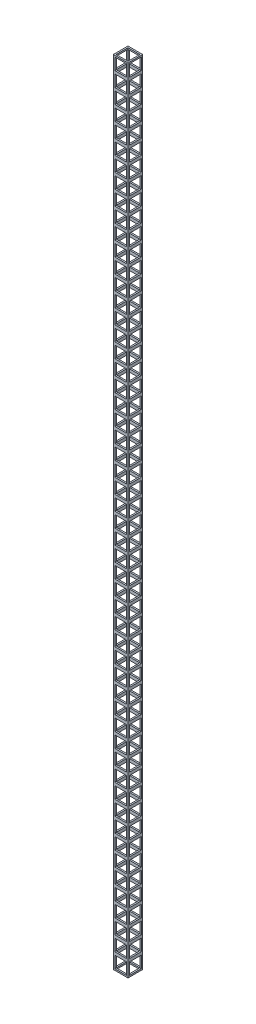
from build123d import *

# Parameters (mm, degrees)
SKIZZE1_W                       = 50
SKIZZE1_H                       = 50
AUFSATZ_LINEAR_AUSTRAGEN1_DEPTH = 2700
SKIZZE2_W                       = 40
SKIZZE2_H                       = 40
SCHNITT_LINEAR_AUSTRAGEN1_DEPTH = 2701.925767214
SKIZZE3_W                       = 40
SKIZZE3_H                       = 40
SCHNITT_LINEAR_AUSTRAGEN2_DEPTH = 2701.925767214
LINEARES_MUSTER1_COUNT          = 54
LINEARES_MUSTER1_PITCH          = 50
SKIZZE4_W                       = 40
SKIZZE4_H                       = 40
SCHNITT_LINEAR_AUSTRAGEN3_DEPTH = 2701.925767214
LINEARES_MUSTER2_COUNT          = 54
LINEARES_MUSTER2_PITCH          = 50


with BuildPart() as part:
    # Skizze1 → Aufsatz-Linear austragen1 (new body)
    with BuildSketch(Plane(origin=(0, 0, 0), x_dir=(1, 0, 0), z_dir=(0, 1, 0))):
        with Locations((25, 25)):
            Rectangle(SKIZZE1_W, SKIZZE1_H)
    extrude(amount=AUFSATZ_LINEAR_AUSTRAGEN1_DEPTH)

    # Skizze2 → Schnitt-Linear austragen1 (cut, through all)
    with BuildSketch(Plane(origin=(0, 2700, 0), x_dir=(1, 0, 0), z_dir=(0, 1, 0))):
        with Locations((25, 25)):
            Rectangle(SKIZZE2_W, SKIZZE2_H)
    extrude(amount=-SCHNITT_LINEAR_AUSTRAGEN1_DEPTH, mode=Mode.SUBTRACT)

    # Skizze3 → Schnitt-Linear austragen2 (cut, symmetric)
    with BuildSketch(Plane(origin=(50, 0, 0), x_dir=(0, 0, -1), z_dir=(1, 0, 0))):
        with Locations((25.17556699, 2675)):
            Rectangle(SKIZZE3_W, SKIZZE3_H)
    schnitt_linear_austragen2 = extrude(amount=SCHNITT_LINEAR_AUSTRAGEN2_DEPTH, both=True, mode=Mode.SUBTRACT)

    # Lineares Muster1: Schnitt-Linear austragen2 ×54
    with Locations(*[(0, -i * LINEARES_MUSTER1_PITCH, 0) for i in range(1, LINEARES_MUSTER1_COUNT)]):
        add(schnitt_linear_austragen2, mode=Mode.SUBTRACT)

    # Skizze4 → Schnitt-Linear austragen3 (cut, symmetric)
    with BuildSketch(Plane(origin=(0, 0, -50), x_dir=(-1, 0, 0), z_dir=(0, 0, -1))):
        with Locations((-25, 2675)):
            Rectangle(SKIZZE4_W, SKIZZE4_H)
    schnitt_linear_austragen3 = extrude(amount=SCHNITT_LINEAR_AUSTRAGEN3_DEPTH, both=True, mode=Mode.SUBTRACT)

    # Lineares Muster2: Schnitt-Linear austragen3 ×54
    with Locations(*[(0, -i * LINEARES_MUSTER2_PITCH, 0) for i in range(1, LINEARES_MUSTER2_COUNT)]):
        add(schnitt_linear_austragen3, mode=Mode.SUBTRACT)


solid = part.part
